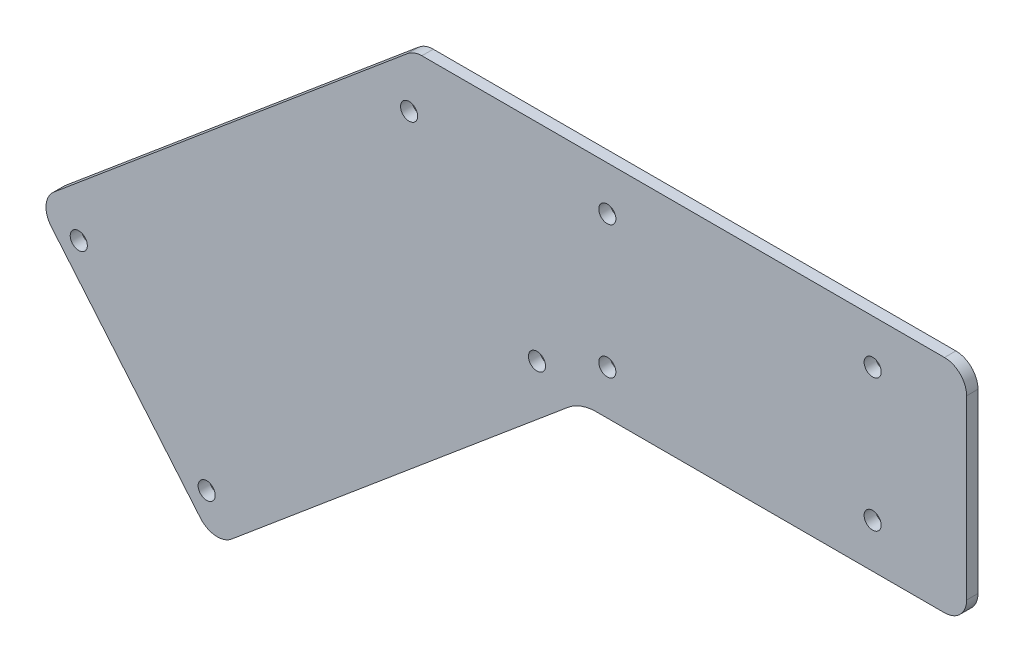
from build123d import *

# Parameters (mm, degrees)
SKETCH1_W                    = 158.75
SKETCH1_H                    = 63.5
BASE_FLANGE1_DEPTH           = 3.2639
F_10_0_1935_DIAMETER_HOLE1_D = 4.9149
BOSS_EXTRUDE1_DEPTH          = 3.2639
F_10_0_1935_DIAMETER_HOLE2_D = 4.9149
FILLET1_R                    = 6.35
FILLET2_R                    = 12.7


# Sheet-metal steps are written as plain solids
with BuildPart() as part:
    # Sketch1 → Base-Flange1 (new body)
    with BuildSketch(Plane.XY):
        with Locations((79.375, 0)):
            Rectangle(SKETCH1_W, SKETCH1_H)
    extrude(amount=-BASE_FLANGE1_DEPTH)

    # #10 (0.1935) Diameter Hole1 (through all)
    with Locations(Plane.XY):
        with Locations((55.5625, 19.05), (55.5625, -19.05), (131.7625, 19.05), (131.7625, -19.05)):
            Hole(F_10_0_1935_DIAMETER_HOLE1_D / 2)

    # Sketch8 → Boss-Extrude1 (add)
    with BuildSketch(Plane.XY):
        Polygon((0, 31.75), (-108.232504257, -59.067854404), (-57.211237738, -119.872632076), (47.809225627, -31.75), (0, -31.75), align=None)
    extrude(amount=-BOSS_EXTRUDE1_DEPTH)

    # #10 (0.1935) Diameter Hole2 (through all)
    with Locations(Plane.XY):
        with Locations((-1.369691562, 16.094353813), (-96.225144731, -63.498821956), (35.365620332, -27.685086111), (-59.489832837, -107.27826188)):
            Hole(F_10_0_1935_DIAMETER_HOLE2_D / 2)

    # Fillet1
    fillet1_edges = [part.edges().sort_by_distance(p)[0] for p in [
        (-108.232504257, -59.067854404, -1.63195),
        (-57.211237738, -119.872632076, -1.63195),
        (0, 31.75, -1.63195),
        (158.75, 31.75, -1.63195),
        (158.75, -31.75, -1.63195),
    ]]
    fillet(fillet1_edges, radius=FILLET1_R)

    # Fillet2
    fillet2_edges = [part.edges().sort_by_distance(p)[0] for p in [
        (47.809225627, -31.75, -1.63195),
    ]]
    fillet(fillet2_edges, radius=FILLET2_R)


solid = part.part
